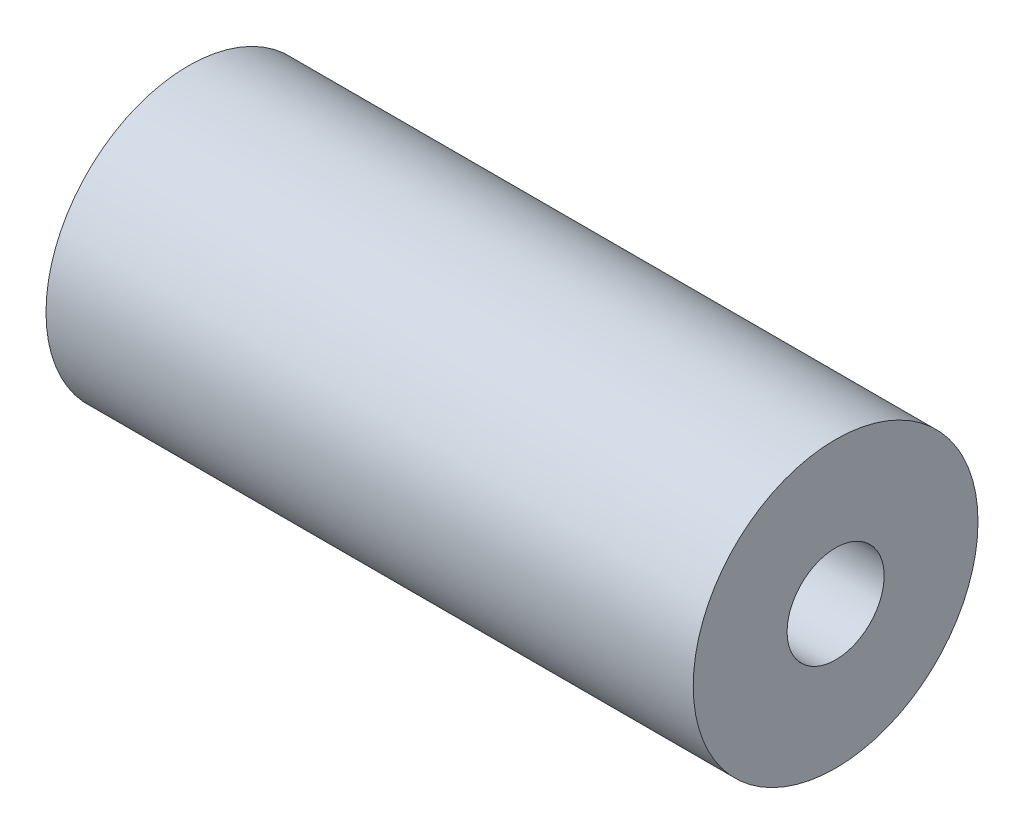
from build123d import *

# Parameters (mm, degrees)
SKETCH1_W = 100
SKETCH1_H = 14.5
SKETCH2_W = 40
SKETCH2_H = 0.5


with BuildPart() as part:
    # Sketch1 → Revolve1 (revolve)
    with BuildSketch(Plane.XY):
        with Locations((50, 14.75)):
            Rectangle(SKETCH1_W, SKETCH1_H)
    revolve(axis=Axis((0, 0, 0), (1, 0, 0)))

    # Sketch2 → Cut-Revolve1 (revolve, cut)
    with BuildSketch(Plane.XY):
        with Locations((50, 7.75)):
            Rectangle(SKETCH2_W, SKETCH2_H)
    revolve(axis=Axis((0, 0, 0), (1, 0, 0)), mode=Mode.SUBTRACT)


solid = part.part
